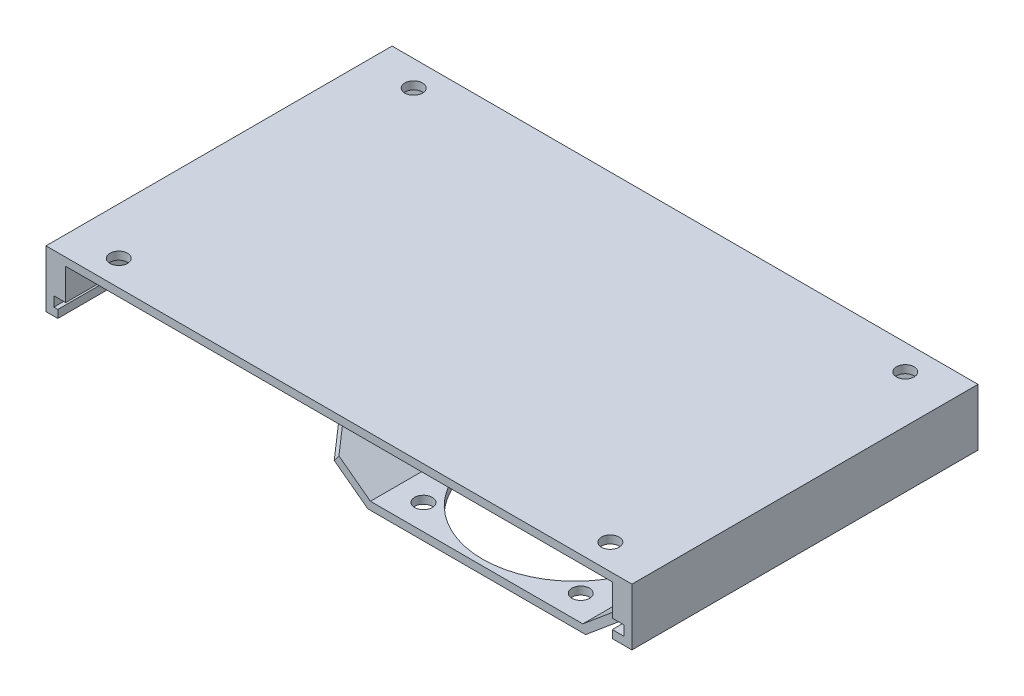
from build123d import *

# Parameters (mm, degrees)
BOSS_EXTRUDE1_DEPTH = 85
BOSS_EXTRUDE2_DEPTH = 3
EXTRUDE_THIN1_DEPTH = 53
CHAMFER1_SIZE       = 10
CHAMFER2_SIZE       = 2
CUT_EXTRUDE1_DEPTH  = 53
SKETCH6_R           = 23.5
SKETCH6_R_2         = 2.25
CUT_EXTRUDE2_DEPTH  = 53
SKETCH7_R           = 2.25
CUT_EXTRUDE3_DEPTH  = 53


with BuildPart() as part:
    # Sketch1 → Boss-Extrude1 (new body)
    with BuildSketch(Plane.XY):
        Polygon((0, 0), (69.5, 0), (69.5, -8), (72.5, -8), (72.5, -10.5), (69.5, -10.5), (69.5, -12.5), (74.5, -12.5), (74.5, -6), (74.5, 2), (71.5, 2), (0, 2), (-71.5, 2), (-74.5, 2), (-74.5, -6), (-74.5, -12.5), (-71.5, -12.5), (-71.5, -10.5), (-72.5, -10.5), (-72.5, -8), (-69.5, -8), (-69.5, 0), align=None)
    extrude(amount=BOSS_EXTRUDE1_DEPTH)

    # Sketch2 → Boss-Extrude2 (add)
    with BuildSketch(Plane(origin=(0, 0, 0), x_dir=(-1, 0, 0), z_dir=(0, 0, -1))):
        Polygon((-27, -48), (27, -48), (74.5, -12.5), (74.5, 2), (-74.5, 2), (-74.5, -12.5), (-69.5, -12.5), align=None)
    extrude(amount=BOSS_EXTRUDE2_DEPTH)

    # Sketch4 → Extrude-Thin1 (add)
    with BuildSketch(Plane(origin=(0, 0, -3), x_dir=(-1, 0, 0), z_dir=(0, 0, -1))):
        Polygon((43.020213309, -36.026998474), (27, -48), (-27, -48), (-42.349613383, -35.178558233), (-43.63175756, -36.713519571), (-27.725407751, -50), (27.664793483, -50), (44.217513462, -37.629019805), align=None)
    extrude(amount=-EXTRUDE_THIN1_DEPTH)

    # Chamfer1
    chamfer1_edges = [part.edges().sort_by_distance(p)[0] for p in [
        (-43.618863385, -36.82800914, 50),
        (42.990685472, -35.946038902, 50),
    ]]
    chamfer(chamfer1_edges, length=CHAMFER1_SIZE)

    # Chamfer2
    chamfer2_edges = [part.edges().sort_by_distance(p)[0] for p in [
        (-43.020213309, -36.026998474, -1.5),
        (42.349613383, -35.178558233, -1.5),
    ]]
    chamfer(chamfer2_edges, length=CHAMFER2_SIZE - 0.0001)  # a hair under: the kernel refuses the full size

    # Sketch5 → Cut-Extrude1 (cut)
    with BuildSketch(Plane.XY):
        with BuildLine():
            Line((-30, -28.267007474), (30, -28.267007474))
            ThreePointArc((30, -28.267007474), (33, -31.267007474), (30, -34.267007474))
            Line((30, -34.267007474), (-30, -34.267007474))
            ThreePointArc((-30, -34.267007474), (-33, -31.267007474), (-30, -28.267007474))
        make_face()
    extrude(amount=-CUT_EXTRUDE1_DEPTH, mode=Mode.SUBTRACT)

    # Sketch6 → Cut-Extrude2 (cut)
    with BuildSketch(Plane(origin=(0, -48, 0), x_dir=(1, 0, 0), z_dir=(0, 1, 0))):
        with Locations(Location((0, -25, 0), (0, 0, 270))):
            Circle(SKETCH6_R)
        with Locations(Location((20, -43.518518519, 0), (0, 0, 270))):
            Circle(SKETCH6_R_2)
        with Locations(Location((-20, -43.518518519, 0), (0, 0, 270))):
            Circle(SKETCH6_R_2)
        with Locations(Location((-20, -6.481481481, 0), (0, 0, 270))):
            Circle(SKETCH6_R_2)
        with Locations(Location((20, -6.481481481, 0), (0, 0, 270))):
            Circle(SKETCH6_R_2)
    extrude(amount=-CUT_EXTRUDE2_DEPTH, mode=Mode.SUBTRACT)

    # Sketch7 → Cut-Extrude3 (cut)
    with BuildSketch(Plane(origin=(0, 2, 0), x_dir=(1, 0, 0), z_dir=(0, 1, 0))):
        with Locations(Location((62.5, -78.5, 0), (0, 0, 270))):
            Circle(SKETCH7_R)
        with Locations(Location((62.5, -3.5, 0), (0, 0, 270))):
            Circle(SKETCH7_R)
        with Locations(Location((-62.5, -3.5, 0), (0, 0, 270))):
            Circle(SKETCH7_R)
        with Locations(Location((-62.5, -78.5, 0), (0, 0, 270))):
            Circle(SKETCH7_R)
    extrude(amount=-CUT_EXTRUDE3_DEPTH, mode=Mode.SUBTRACT)


solid = part.part
